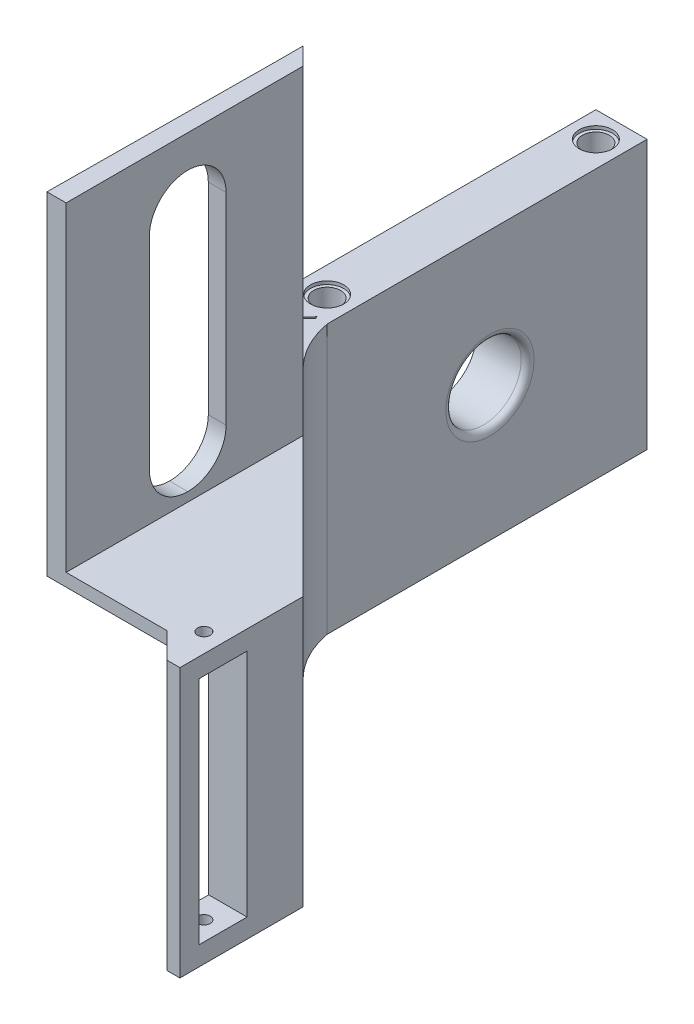
from build123d import *

# Parameters (mm, degrees)
SKETCH1_W           = 25
SKETCH1_H           = 50
SKETCH1_R           = 3.4
BOSS_EXTRUDE1_DEPTH = 3
SKETCH2_W           = 50
SKETCH2_H           = 3
BOSS_EXTRUDE2_DEPTH = 8
SKETCH3_W           = 8
SKETCH3_H           = 50
BOSS_EXTRUDE3_DEPTH = 42
SKETCH4_R           = 2.65
CUT_EXTRUDE1_DEPTH  = 0.5
SKETCH5_R           = 5.888972746
CUT_EXTRUDE2_DEPTH  = 9
FILLET2_R           = 1
SKETCH6_R           = 12.6
BOSS_EXTRUDE4_DEPTH = 2
FILLET4_R           = 1
SKETCH8_R           = 1.589780168
SKETCH8_R_2         = 1.777428262
CUT_EXTRUDE3_DEPTH  = 10
SKETCH9_W           = 49.021678163
SKETCH9_H           = 20.976854622
CUT_EXTRUDE4_DEPTH  = 68.79439129
SKETCH11_R          = 2.1
CUT_EXTRUDE5_DEPTH  = 59.480168703
SKETCH14_R          = 2.6
CUT_EXTRUDE6_DEPTH  = 0.5
BOSS_EXTRUDE5_DEPTH = 42
FILLET5_R           = 15
BOSS_EXTRUDE6_DEPTH = 42
SKETCH18_W          = 7.5
SKETCH18_H          = 36
CUT_EXTRUDE7_DEPTH  = 8
SKETCH19_R          = 1
CUT_EXTRUDE8_DEPTH  = 87.640868929
FILL_START          = -24.41711757
FILL_PATTERN1_DEPTH = 4.904046836
CHAMFER1_SIZE       = 4
CUT_EXTRUDE9_DEPTH  = 87.640868929
BOSS_EXTRUDE7_DEPTH = 2
BOSS_EXTRUDE8_DEPTH = 50
SKETCH23_W          = 11.999634841
SKETCH23_H          = 43.48627111
CUT_EXTRUDE10_DEPTH = 91.643207427
FILLET6_R           = 6
FILLET7_R           = 6
FILLET8_R           = 6
FILLET9_R           = 6


# Read off the part's stored shape, not the designer's step: Fill Pattern1
with BuildPart() as part:
    # Sketch1 → Boss-Extrude1 (new body)
    with BuildSketch(Plane(origin=(0, 0, 0), x_dir=(1, 0, 0), z_dir=(0, 1, 0))):
        with Locations((2.276951673, 11.384758364)):
            Rectangle(SKETCH1_W, SKETCH1_H)
        with Locations(Location((1.276951673, 11.384758364, 0), (0, 0, 270))):
            Circle(SKETCH1_R, mode=Mode.SUBTRACT)
    extrude(amount=BOSS_EXTRUDE1_DEPTH)

    # Sketch2 → Boss-Extrude2 (add)
    with BuildSketch(Plane.ZY.offset(10.223048327)):
        with Locations((-11.384758364, 1.5)):
            Rectangle(SKETCH2_W, SKETCH2_H)
    extrude(amount=BOSS_EXTRUDE2_DEPTH)

    # Sketch3 → Boss-Extrude3 (add)
    with BuildSketch(Plane.XZ):
        with Locations((-14.223048327, -11.384758364)):
            Rectangle(SKETCH3_W, SKETCH3_H)
    extrude(amount=BOSS_EXTRUDE3_DEPTH)

    # Sketch4 → Cut-Extrude1 (cut)
    with BuildSketch(Plane(origin=(0, 3, 0), x_dir=(1, 0, 0), z_dir=(0, 1, 0))):
        with Locations(Location((-14.223048327, 32.384758364, 0), (0, 0, 270))):
            Circle(SKETCH4_R)
        with Locations(Location((-14.223048327, -9.615241636, 0), (0, 0, 270))):
            Circle(SKETCH4_R)
    cut_extrude1 = extrude(amount=-CUT_EXTRUDE1_DEPTH, mode=Mode.SUBTRACT)

    # Mirror1: Cut-Extrude1 across plane
    add(cut_extrude1.mirror(Plane.ZX.offset(-19.5)), mode=Mode.SUBTRACT)

    # Sketch5 → Cut-Extrude2 (cut)
    with BuildSketch(Plane.ZY.offset(18.223048327)):
        with Locations((-11.836279124, -21)):
            Circle(SKETCH5_R)
    extrude(amount=-CUT_EXTRUDE2_DEPTH, mode=Mode.SUBTRACT)

    # Fillet2
    fillet2_edges = [part.edges().sort_by_distance(p)[0] for p in [
        (-10.223048327, -21, -17.72525187),
    ]]
    fillet(fillet2_edges, radius=FILLET2_R)

    # Mirror2: Cut-Extrude1 across plane
    add(cut_extrude1.mirror(Plane.ZY.offset(1.723048327)), mode=Mode.SUBTRACT)

    # Sketch6 → Boss-Extrude4 (add)
    with BuildSketch(Plane(origin=(0, 3, 0), x_dir=(1, 0, 0), z_dir=(0, 1, 0))):
        with BuildLine():
            Line((14.776951673, 5.825082115), (14.776951673, 16.944434614))
            ThreePointArc((14.776951673, 16.944434614), (-13.323048327, 11.384758364), (14.776951673, 5.825082115))
        make_face()
        with Locations(Location((1.276951673, 11.384758364, 0), (0, 0, 270))):
            Circle(SKETCH6_R, mode=Mode.SUBTRACT)
    extrude(amount=BOSS_EXTRUDE4_DEPTH)

    # Fillet4
    # the kernel refuses this fillet: 1 mm, written as the material it takes off along each edge
    with BuildSketch(Plane(origin=(14.776951673, 5, -3.325082115), x_dir=(0, -1, 0), z_dir=(0, 0, -1))) as fillet4_piece_1:
        with BuildLine():
            CenterArc((FILLET4_R, FILLET4_R), FILLET4_R, 180, 90)
            Line((0, FILLET4_R), (0, 0))
            Line((0, 0), (FILLET4_R, 0))
        make_face()
    extrude(amount=16.119352499, mode=Mode.SUBTRACT)

    # Sketch8 → Cut-Extrude3 (cut)
    with BuildSketch(Plane(origin=(0, 3, 0), x_dir=(1, 0, 0), z_dir=(0, 1, 0))):
        with Locations(Location((1.276951673, 19.884758364, 0), (0, 0, 270))):
            Circle(SKETCH8_R)
        with Locations(Location((1.276951673, 2.884758364, 0), (0, 0, 270))):
            Circle(SKETCH8_R_2)
    extrude(amount=-CUT_EXTRUDE3_DEPTH, mode=Mode.SUBTRACT)

    # Sketch9 → Cut-Extrude4 (cut, through all)
    with BuildSketch(Plane.XY.offset(13.615241636)):
        with Locations((-9.733887409, 10.488427311)):
            Rectangle(SKETCH9_W, SKETCH9_H)
    extrude(amount=-CUT_EXTRUDE4_DEPTH, mode=Mode.SUBTRACT)

    # Sketch11 → Cut-Extrude5 (cut, through all)
    with BuildSketch(Plane(origin=(0, 0, 0), x_dir=(1, 0, 0), z_dir=(0, 1, 0))):
        with Locations(Location((-14.223048327, 32.384758364, 0), (0, 0, 270))):
            Circle(SKETCH11_R)
    cut_extrude5 = extrude(amount=-CUT_EXTRUDE5_DEPTH, mode=Mode.SUBTRACT)

    # Mirror3: Cut-Extrude5 across plane
    add(cut_extrude5.mirror(Plane.XY.offset(-11.384758364)), mode=Mode.SUBTRACT)

    # Sketch14 → Cut-Extrude6 (cut)
    with BuildSketch(Plane(origin=(0, 0, 0), x_dir=(1, 0, 0), z_dir=(0, 1, 0))):
        with Locations(Location((-14.223048327, -9.615241636, 0), (0, 0, 270))):
            Circle(SKETCH14_R)
    cut_extrude6 = extrude(amount=-CUT_EXTRUDE6_DEPTH, mode=Mode.SUBTRACT)

    # Mirror4: Cut-Extrude6 across plane
    add(cut_extrude6.mirror(Plane.XY.offset(-11.384758364)), mode=Mode.SUBTRACT)

    # Sketch16 → Boss-Extrude5 (add)
    with BuildSketch(Plane(origin=(0, 0, 0), x_dir=(1, 0, 0), z_dir=(0, 1, 0))):
        Polygon((-18.223048327, -13.615241636), (24.776951673, -56.615241636), (24.776951673, -52.372600949), (-13.98040764, -13.615241636), align=None)
    extrude(amount=-BOSS_EXTRUDE5_DEPTH)

    # Fillet5
    # the kernel refuses this fillet: 15 mm, written as the material it adds along each edge
    with BuildSketch(Plane(origin=(-13.98040764, 0, 13.615241636), x_dir=(1, 0, 0), z_dir=(0, -1, 0))) as fillet5_piece_1:
        with BuildLine():
            CenterArc((18.512169169, -2.701034267), FILLET5_R, 135, 34.626223963)
            Line((7.905567451, 7.905567451), (0, 0))
            Line((0, 0), (3.757359313, 0))
        make_face()
    extrude(amount=42)

    # Sketch17 → Boss-Extrude6 (add)
    with BuildSketch(Plane(origin=(0, 0, 0), x_dir=(1, 0, 0), z_dir=(0, 1, 0))):
        Polygon((24.776951673, -56.615241636), (24.776951673, -71.615241636), (18.776951673, -71.615241636), (18.776951673, -50.615241636), align=None)
    extrude(amount=-BOSS_EXTRUDE6_DEPTH)

    # Sketch18 → Cut-Extrude7 (cut)
    with BuildSketch(Plane(origin=(24.776951673, 0, 0), x_dir=(0, 0, -1), z_dir=(1, 0, 0))):
        with Locations((-64.865241636, -21)):
            Rectangle(SKETCH18_W, SKETCH18_H)
    extrude(amount=-CUT_EXTRUDE7_DEPTH, mode=Mode.SUBTRACT)

    # Sketch19 → Cut-Extrude8 (cut, through all)
    with BuildSketch(Plane(origin=(0, 0, 0), x_dir=(1, 0, 0), z_dir=(0, 1, 0))):
        with Locations(Location((21.776951673, -64.865241636, 0), (0, 0, 270))):
            Circle(SKETCH19_R)
    extrude(amount=-CUT_EXTRUDE8_DEPTH, mode=Mode.SUBTRACT)

    # Fill Pattern1 outline → Fill Pattern1 (cut)
    with BuildSketch(Plane(origin=(0, 0, 0), x_dir=(0.7071067811865468, 0, 0.7071067811865482), z_dir=(0.7071067811865481, 0, -0.707106781186547)).offset(FILL_START)):
        Polygon((45.971737286, 5.859685187), (47.221737286, 3.694621678), (49.721737286, 3.694621678), (50.971737286, 5.859685187), (49.721737286, 8.024748697), (47.221737286, 8.024748697), align=None)
        Polygon((30.237460587, 33.11225185), (31.487460587, 30.947188341), (33.987460587, 30.947188341), (35.237460587, 33.11225185), (33.987460587, 35.27731536), (31.487460587, 35.27731536), align=None)
        Polygon((40.726978386, 14.943874075), (41.976978386, 12.778810565), (44.476978386, 12.778810565), (45.726978386, 14.943874075), (44.476978386, 17.108937584), (41.976978386, 17.108937584), align=None)
        Polygon((35.482219487, 24.028062963), (36.732219487, 21.862999453), (39.232219487, 21.862999453), (40.482219487, 24.028062963), (39.232219487, 26.193126472), (36.732219487, 26.193126472), align=None)
        Polygon((15.753183888, 3.694621678), (18.253183888, 3.694621678), (19.503183888, 5.859685187), (18.253183888, 8.024748697), (15.753183888, 8.024748697), (14.503183888, 5.859685187), align=None)
        Polygon((26.242701687, 3.694621678), (28.742701687, 3.694621678), (29.992701687, 5.859685187), (28.742701687, 8.024748697), (26.242701687, 8.024748697), (24.992701687, 5.859685187), align=None)
        Polygon((36.732219487, 3.694621678), (39.232219487, 3.694621678), (40.482219487, 5.859685187), (39.232219487, 8.024748697), (36.732219487, 8.024748697), (35.482219487, 5.859685187), align=None)
        Polygon((45.971737286, 11.915811112), (47.221737286, 9.750747603), (49.721737286, 9.750747603), (50.971737286, 11.915811112), (49.721737286, 14.080874622), (47.221737286, 14.080874622), align=None)
        Polygon((40.726978386, 21), (41.976978386, 18.834936491), (44.476978386, 18.834936491), (45.726978386, 21), (44.476978386, 23.165063509), (41.976978386, 23.165063509), align=None)
        Polygon((35.482219487, 30.084188888), (36.732219487, 27.919125378), (39.232219487, 27.919125378), (40.482219487, 30.084188888), (39.232219487, 32.249252397), (36.732219487, 32.249252397), align=None)
        Polygon((15.753183888, 9.750747603), (18.253183888, 9.750747603), (19.503183888, 11.915811112), (18.253183888, 14.080874622), (15.753183888, 14.080874622), (14.503183888, 11.915811112), align=None)
        Polygon((26.242701687, 9.750747603), (28.742701687, 9.750747603), (29.992701687, 11.915811112), (28.742701687, 14.080874622), (26.242701687, 14.080874622), (24.992701687, 11.915811112), align=None)
        Polygon((36.732219487, 9.750747603), (39.232219487, 9.750747603), (40.482219487, 11.915811112), (39.232219487, 14.080874622), (36.732219487, 14.080874622), (35.482219487, 11.915811112), align=None)
        Polygon((45.971737286, 17.971937037), (47.221737286, 15.806873528), (49.721737286, 15.806873528), (50.971737286, 17.971937037), (49.721737286, 20.137000547), (47.221737286, 20.137000547), align=None)
        Polygon((40.726978386, 27.056125925), (41.976978386, 24.891062416), (44.476978386, 24.891062416), (45.726978386, 27.056125925), (44.476978386, 29.221189435), (41.976978386, 29.221189435), align=None)
        Polygon((35.482219487, 36.140314813), (36.732219487, 33.975251303), (39.232219487, 33.975251303), (40.482219487, 36.140314813), (39.232219487, 38.305378322), (36.732219487, 38.305378322), align=None)
        Polygon((15.753183888, 15.806873528), (18.253183888, 15.806873528), (19.503183888, 17.971937037), (18.253183888, 20.137000547), (15.753183888, 20.137000547), (14.503183888, 17.971937037), align=None)
        Polygon((26.242701687, 15.806873528), (28.742701687, 15.806873528), (29.992701687, 17.971937037), (28.742701687, 20.137000547), (26.242701687, 20.137000547), (24.992701687, 17.971937037), align=None)
        Polygon((36.732219487, 15.806873528), (39.232219487, 15.806873528), (40.482219487, 17.971937037), (39.232219487, 20.137000547), (36.732219487, 20.137000547), (35.482219487, 17.971937037), align=None)
        Polygon((44.476978386, 6.72268464), (45.726978386, 8.88774815), (44.476978386, 11.052811659), (41.976978386, 11.052811659), (40.726978386, 8.88774815), (41.976978386, 6.72268464), align=None)
        Polygon((45.971737286, 24.028062963), (47.221737286, 21.862999453), (49.721737286, 21.862999453), (50.971737286, 24.028062963), (49.721737286, 26.193126472), (47.221737286, 26.193126472), align=None)
        Polygon((40.726978386, 33.11225185), (41.976978386, 30.947188341), (44.476978386, 30.947188341), (45.726978386, 33.11225185), (44.476978386, 35.27731536), (41.976978386, 35.27731536), align=None)
        Polygon((15.753183888, 21.862999453), (18.253183888, 21.862999453), (19.503183888, 24.028062963), (18.253183888, 26.193126472), (15.753183888, 26.193126472), (14.503183888, 24.028062963), align=None)
        Polygon((26.242701687, 21.862999453), (28.742701687, 21.862999453), (29.992701687, 24.028062963), (28.742701687, 26.193126472), (26.242701687, 26.193126472), (24.992701687, 24.028062963), align=None)
        Polygon((45.971737286, 36.140314813), (47.221737286, 33.975251303), (49.721737286, 33.975251303), (50.971737286, 36.140314813), (49.721737286, 38.305378322), (47.221737286, 38.305378322), align=None)
        Polygon((15.753183888, 33.975251303), (18.253183888, 33.975251303), (19.503183888, 36.140314813), (18.253183888, 38.305378322), (15.753183888, 38.305378322), (14.503183888, 36.140314813), align=None)
        Polygon((26.242701687, 33.975251303), (28.742701687, 33.975251303), (29.992701687, 36.140314813), (28.742701687, 38.305378322), (26.242701687, 38.305378322), (24.992701687, 36.140314813), align=None)
        Polygon((33.987460587, 6.72268464), (35.237460587, 8.88774815), (33.987460587, 11.052811659), (31.487460587, 11.052811659), (30.237460587, 8.88774815), (31.487460587, 6.72268464), align=None)
        Polygon((45.971737286, 30.084188888), (47.221737286, 27.919125378), (49.721737286, 27.919125378), (50.971737286, 30.084188888), (49.721737286, 32.249252397), (47.221737286, 32.249252397), align=None)
        Polygon((15.753183888, 27.919125378), (18.253183888, 27.919125378), (19.503183888, 30.084188888), (18.253183888, 32.249252397), (15.753183888, 32.249252397), (14.503183888, 30.084188888), align=None)
        Polygon((26.242701687, 27.919125378), (28.742701687, 27.919125378), (29.992701687, 30.084188888), (28.742701687, 32.249252397), (26.242701687, 32.249252397), (24.992701687, 30.084188888), align=None)
        Polygon((19.747942788, 27.056125925), (20.997942788, 24.891062416), (23.497942788, 24.891062416), (24.747942788, 27.056125925), (23.497942788, 29.221189435), (20.997942788, 29.221189435), align=None)
        Polygon((19.747942788, 8.88774815), (20.997942788, 6.72268464), (23.497942788, 6.72268464), (24.747942788, 8.88774815), (23.497942788, 11.052811659), (20.997942788, 11.052811659), align=None)
        Polygon((33.987460587, 24.891062416), (35.237460587, 27.056125925), (33.987460587, 29.221189435), (31.487460587, 29.221189435), (30.237460587, 27.056125925), (31.487460587, 24.891062416), align=None)
        Polygon((19.747942788, 14.943874075), (20.997942788, 12.778810565), (23.497942788, 12.778810565), (24.747942788, 14.943874075), (23.497942788, 17.108937584), (20.997942788, 17.108937584), align=None)
        Polygon((31.487460587, 12.778810565), (33.987460587, 12.778810565), (35.237460587, 14.943874075), (33.987460587, 17.108937584), (31.487460587, 17.108937584), (30.237460587, 14.943874075), align=None)
        Polygon((19.747942788, 21), (20.997942788, 18.834936491), (23.497942788, 18.834936491), (24.747942788, 21), (23.497942788, 23.165063509), (20.997942788, 23.165063509), align=None)
        Polygon((31.487460587, 18.834936491), (33.987460587, 18.834936491), (35.237460587, 21), (33.987460587, 23.165063509), (31.487460587, 23.165063509), (30.237460587, 21), align=None)
        Polygon((20.997942788, 30.947188341), (23.497942788, 30.947188341), (24.747942788, 33.11225185), (23.497942788, 35.27731536), (20.997942788, 35.27731536), (19.747942788, 33.11225185), align=None)
    extrude(amount=FILL_PATTERN1_DEPTH, mode=Mode.SUBTRACT)

    # Chamfer1
    # the kernel refuses this chamfer: 4 mm, written as the material it takes off along each edge
    with BuildSketch(Plane(origin=(18.776951673, 10.286731952, 71.615241636), x_dir=(0.9996219169112968, 0, 0.027495876610585623), z_dir=(0, -1, 0))) as chamfer1_piece_1:
        Polygon((CHAMFER1_SIZE * 0.999621916911, -CHAMFER1_SIZE * 0.0274958766106), (-CHAMFER1_SIZE * 0.0274958766106, -CHAMFER1_SIZE * 0.999621916911), (0, 0), align=None)
    extrude(amount=62.573463904, mode=Mode.SUBTRACT)

    # Sketch20 → Cut-Extrude9 (cut, through all)
    with BuildSketch(Plane(origin=(0, 0, 0), x_dir=(1, 0, 0), z_dir=(0, 1, 0))):
        Polygon((-12.007369699, -13.422049918), (-13.646299524, -15.19356362), (-10.796749548, -17.829847178), (-10.525107778, -17.536230508), (-13.131913788, -15.124523438), (-11.876337797, -13.743390342), align=None)
    extrude(amount=-CUT_EXTRUDE9_DEPTH, mode=Mode.SUBTRACT)

    # Sketch21 → Boss-Extrude7 (add)
    with BuildSketch(Plane(origin=(0, 0, 0), x_dir=(1, 0, 0), z_dir=(0, 1, 0))):
        Polygon((18.776951673, -67.615241636), (0, -67.615241636), (0.276951673, -32.115241636), (18.776951673, -50.615241636), align=None)
    extrude(amount=-BOSS_EXTRUDE7_DEPTH)

    # Sketch22 → Boss-Extrude8 (add)
    with BuildSketch(Plane(origin=(0, 0, 0), x_dir=(1, 0, 0), z_dir=(0, 1, 0))):
        Polygon((0, -67.615241636), (0.276951673, -32.115241636), (0.276951673, -27.872600949), (3, -30.595649276), (3, -67.615241636), align=None)
    extrude(amount=BOSS_EXTRUDE8_DEPTH)

    # Sketch23 → Cut-Extrude10 (cut, through all)
    with BuildSketch(Plane(origin=(0.527465201, 0, 0.004114996), x_dir=(-0.007801218175567637, 0, 0.9999695700344972), z_dir=(-0.9999695700344972, 0, -0.007801218175567637))):
        with Locations((48.589962083, 23.171442648)):
            Rectangle(SKETCH23_W, SKETCH23_H)
    extrude(amount=-CUT_EXTRUDE10_DEPTH, mode=Mode.SUBTRACT)

    # Fillet6
    fillet6_edges = [part.edges().sort_by_distance(p)[0] for p in [
        (1.597605095, 44.914578203, 42.603904364),
    ]]
    fillet(fillet6_edges, radius=FILLET6_R)

    # Fillet7
    # the kernel refuses this fillet: 6 mm, written as the material it adds along each edge
    with BuildSketch(Plane(origin=(0.101598421, 44.914578203, 54.592233334), x_dir=(0.007801218175567638, 0, -0.9999695700344972), z_dir=(0.9999695700344973, 0, 0.007801218175567638))) as fillet7_piece_1_section:
        with BuildLine():
            CenterArc((FILLET7_R, -FILLET7_R), FILLET7_R, 90, 90)
            Line((0, -FILLET7_R), (-FILLET7_R * 0.02, -FILLET7_R))
            Line((-FILLET7_R * 0.02, -FILLET7_R), (-FILLET7_R * 0.02, FILLET7_R * 0.02))
            Line((-FILLET7_R * 0.02, FILLET7_R * 0.02), (FILLET7_R, FILLET7_R * 0.02))
            Line((FILLET7_R, FILLET7_R * 0.02), (FILLET7_R, 0))
        make_face()
    fillet7_piece_1 = extrude(amount=17.89848978, mode=Mode.PRIVATE)
    fillet7_piece_1 = split(fillet7_piece_1, bisect_by=Plane(origin=(3, 43.553537309, 53.249688452), z_dir=(-1, 0, 0)), keep=Keep.TOP, mode=Mode.PRIVATE)
    add(fillet7_piece_1)

    # Fillet8
    fillet8_edges = [part.edges().sort_by_distance(p)[0] for p in [
        (1.597605095, 1.428307093, 42.603904364),
    ]]
    fillet(fillet8_edges, radius=FILLET8_R)

    # Fillet9
    # the kernel refuses this fillet: 6 mm, written as the material it adds along each edge
    with BuildSketch(Plane(origin=(0.101598421, 1.428307093, 54.592233334), x_dir=(0.007801218175567638, 0, -0.9999695700344972), z_dir=(0.9999695700344973, 0, 0.007801218175567638))) as fillet9_piece_1_section:
        with BuildLine():
            CenterArc((FILLET9_R, FILLET9_R), FILLET9_R, 180, 90)
            Line((0, FILLET9_R), (-FILLET9_R * 0.02, FILLET9_R))
            Line((-FILLET9_R * 0.02, FILLET9_R), (-FILLET9_R * 0.02, -FILLET9_R * 0.02))
            Line((-FILLET9_R * 0.02, -FILLET9_R * 0.02), (FILLET9_R, -FILLET9_R * 0.02))
            Line((FILLET9_R, -FILLET9_R * 0.02), (FILLET9_R, 0))
        make_face()
    fillet9_piece_1 = extrude(amount=17.89848978, mode=Mode.PRIVATE)
    fillet9_piece_1 = split(fillet9_piece_1, bisect_by=Plane(origin=(3, 2.789347988, 53.249688452), z_dir=(-1, 0, 0)), keep=Keep.TOP, mode=Mode.PRIVATE)
    add(fillet9_piece_1)


solid = part.part
